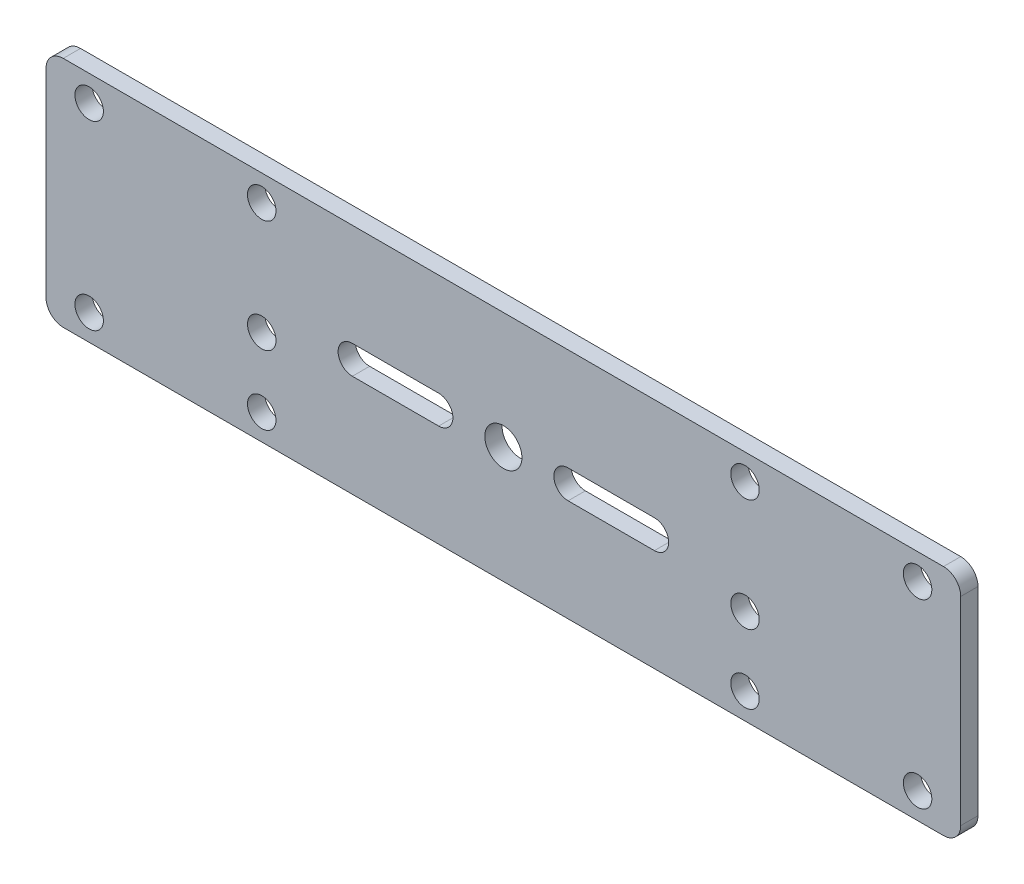
from build123d import *

# Parameters (mm, degrees)
SKETCH_1_W          = 106
SKETCH_1_H          = 25
SKETCH_1_R          = 1.65
SKETCH_1_R_2        = 2.15
EXTRUDE_1_DEPTH     = 2
SKETCH_2_W          = 106
SKETCH_2_H          = 6
EXTRUDE_3_DEPTH     = 2
SKETCH_4_R          = 1.65
CUT_EXTRUDE_1_DEPTH = 57.171612047
CUT_EXTRUDE_2_DEPTH = 10
SKETCH_6_W          = 106
SKETCH_6_H          = 4
CUT_EXTRUDE_3_DEPTH = 57.171612047
FILLET_1_R          = 2


with BuildPart() as part:
    # 草图1 → 凸台-拉伸1 (new body)
    with BuildSketch(Plane.XY):
        Rectangle(SKETCH_1_W, SKETCH_1_H)
        with Locations((-28, 5.5)):
            Circle(SKETCH_1_R, mode=Mode.SUBTRACT)
        with Locations((-28, -7.5)):
            Circle(SKETCH_1_R, mode=Mode.SUBTRACT)
        with Locations((28, -7.5)):
            Circle(SKETCH_1_R, mode=Mode.SUBTRACT)
        with Locations((28, 5.5)):
            Circle(SKETCH_1_R, mode=Mode.SUBTRACT)
        with Locations((-48, 5.5)):
            Circle(SKETCH_1_R, mode=Mode.SUBTRACT)
        with Locations((48, 5.5)):
            Circle(SKETCH_1_R, mode=Mode.SUBTRACT)
        with Locations((0, -5)):
            Circle(SKETCH_1_R_2, mode=Mode.SUBTRACT)
    extrude(amount=EXTRUDE_1_DEPTH)

    # 草图2 → 凸台-拉伸3 (add)
    with BuildSketch(Plane.XY.offset(2)):
        with Locations((0, -15.5)):
            Rectangle(SKETCH_2_W, SKETCH_2_H)
    extrude(amount=-EXTRUDE_3_DEPTH)

    # 草图4 → 切除-拉伸1 (cut, through all)
    with BuildSketch(Plane.XY.offset(2)):
        with Locations((-48, -15.5)):
            Circle(SKETCH_4_R)
        with Locations((48, -15.5)):
            Circle(SKETCH_4_R)
        with Locations((-28, -15.5)):
            Circle(SKETCH_4_R)
        with Locations((28, -15.5)):
            Circle(SKETCH_4_R)
    extrude(amount=-CUT_EXTRUDE_1_DEPTH, mode=Mode.SUBTRACT)

    # 草图5 → 切除-拉伸2 (cut)
    with BuildSketch(Plane.XY.offset(2)):
        with BuildLine():
            Line((-17.5, -3.35), (-7.5, -3.35))
            ThreePointArc((-7.5, -3.35), (-5.85, -5), (-7.5, -6.65))
            Line((-7.5, -6.65), (-17.5, -6.65))
            ThreePointArc((-17.5, -6.65), (-19.15, -5), (-17.5, -3.35))
        make_face()
        with BuildLine():
            Line((17.5, -3.35), (7.5, -3.35))
            ThreePointArc((7.5, -3.35), (5.85, -5), (7.5, -6.65))
            Line((7.5, -6.65), (17.5, -6.65))
            ThreePointArc((17.5, -6.65), (19.15, -5), (17.5, -3.35))
        make_face()
    extrude(amount=-CUT_EXTRUDE_2_DEPTH, mode=Mode.SUBTRACT)

    # 草图6 → 切除-拉伸3 (cut, through all)
    with BuildSketch(Plane.XY.offset(2)):
        with Locations((0, 10.5)):
            Rectangle(SKETCH_6_W, SKETCH_6_H)
    extrude(amount=-CUT_EXTRUDE_3_DEPTH, mode=Mode.SUBTRACT)

    # 圆角1
    fillet_1_edges = [part.edges().sort_by_distance(p)[0] for p in [
        (53, 8.5, 1),
        (53, -18.5, 1),
        (-53, -18.5, 1),
        (-53, 8.5, 1),
    ]]
    fillet(fillet_1_edges, radius=FILLET_1_R)


solid = part.part
